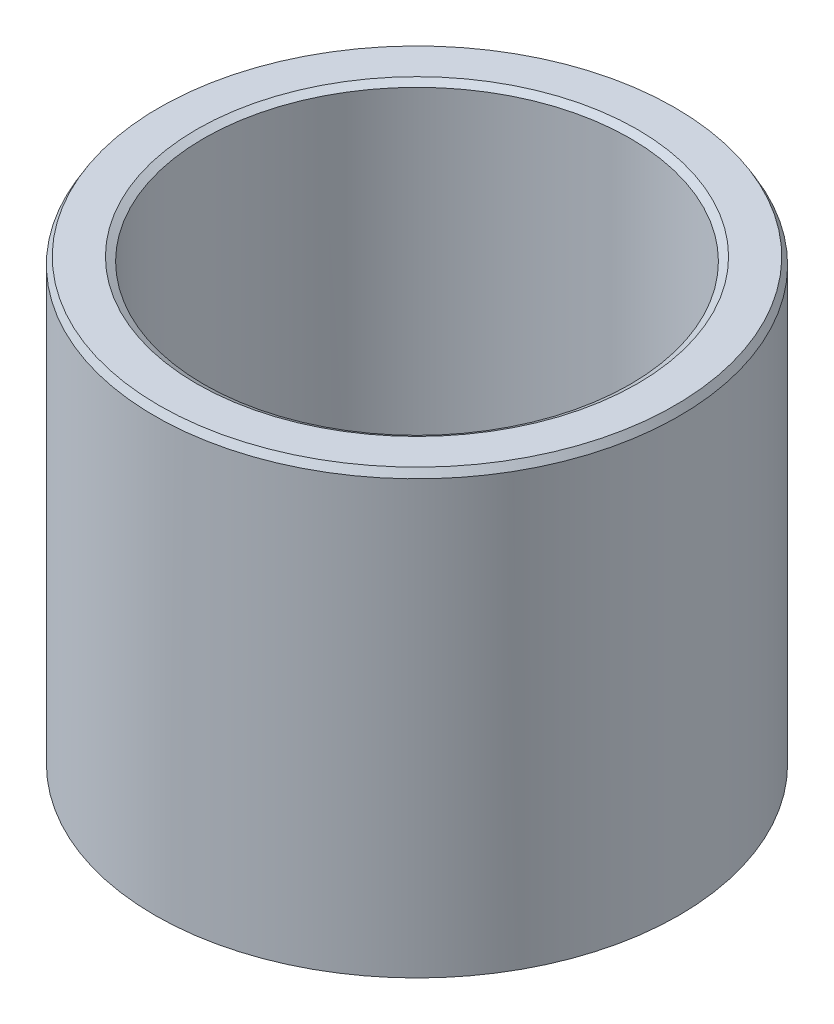
from build123d import *
from OCP.BRepFilletAPI import BRepFilletAPI_MakeChamfer

# Parameters (mm, degrees)
SKETCH1_R           = 47.5
BOSS_EXTRUDE1_DEPTH = 80.404486778
SKETCH2_R           = 38.63176066
CUT_EXTRUDE1_DEPTH  = 105.772999833
CHAMFER1_SIZE       = 1.301607768
CHAMFER1_SIZE2      = 0.751483595


with BuildPart() as part:
    # Sketch1 → Boss-Extrude1 (new body)
    with BuildSketch(Plane(origin=(0, 0, 0), x_dir=(1, 0, 0), z_dir=(0, 1, 0))):
        Circle(SKETCH1_R)
    extrude(amount=BOSS_EXTRUDE1_DEPTH)

    # Sketch2 → Cut-Extrude1 (cut, through all)
    with BuildSketch(Plane(origin=(0, 0, 0), x_dir=(1, 0, 0), z_dir=(0, 1, 0))):
        Circle(SKETCH2_R)
    extrude(amount=CUT_EXTRUDE1_DEPTH, mode=Mode.SUBTRACT)

    # Chamfer1: one chamfer whose edges measure the first distance from different faces: ONE call of the kernel's chamfer builder (chamfer() names one face for all edges)
    chamfer1_edges_1 = [part.edges().sort_by_distance(p)[0] for p in [
        (-38.63176066, 80.404486778, 0),
    ]]
    chamfer1_side_1 = [part.faces().sort_by_distance(p)[0] for p in [
        (-46.156497116, 80.404486778, 0),
    ]]
    chamfer1_edges_2 = [part.edges().sort_by_distance(p)[0] for p in [
        (-38.63176066, 0, 0),
    ]]
    chamfer1_side_2 = [part.faces().sort_by_distance(p)[0] for p in [
        (-38.63176066, 40.202243389, 0),
    ]]
    chamfer1_edges_3 = [part.edges().sort_by_distance(p)[0] for p in [
        (-47.5, 0, 0),
    ]]
    chamfer1_side_3 = [part.faces().sort_by_distance(p)[0] for p in [
        (-46.156497116, 0, 0),
    ]]
    chamfer1_edges_4 = [part.edges().sort_by_distance(p)[0] for p in [
        (-47.5, 80.404486778, 0),
    ]]
    chamfer1_side_4 = [part.faces().sort_by_distance(p)[0] for p in [
        (-47.5, 40.202243389, 0),
    ]]
    chamfer1 = BRepFilletAPI_MakeChamfer(part.part.solid().wrapped)
    for e in chamfer1_edges_1:
        chamfer1.Add(CHAMFER1_SIZE, CHAMFER1_SIZE2, e.wrapped, chamfer1_side_1[0].wrapped)  # the first distance lies on this face
    for e in chamfer1_edges_2:
        chamfer1.Add(CHAMFER1_SIZE, CHAMFER1_SIZE2, e.wrapped, chamfer1_side_2[0].wrapped)  # the first distance lies on this face
    for e in chamfer1_edges_3:
        chamfer1.Add(CHAMFER1_SIZE, CHAMFER1_SIZE2, e.wrapped, chamfer1_side_3[0].wrapped)  # the first distance lies on this face
    for e in chamfer1_edges_4:
        chamfer1.Add(CHAMFER1_SIZE, CHAMFER1_SIZE2, e.wrapped, chamfer1_side_4[0].wrapped)  # the first distance lies on this face
    add(Compound.cast(chamfer1.Shape()), mode=Mode.REPLACE)


solid = part.part
